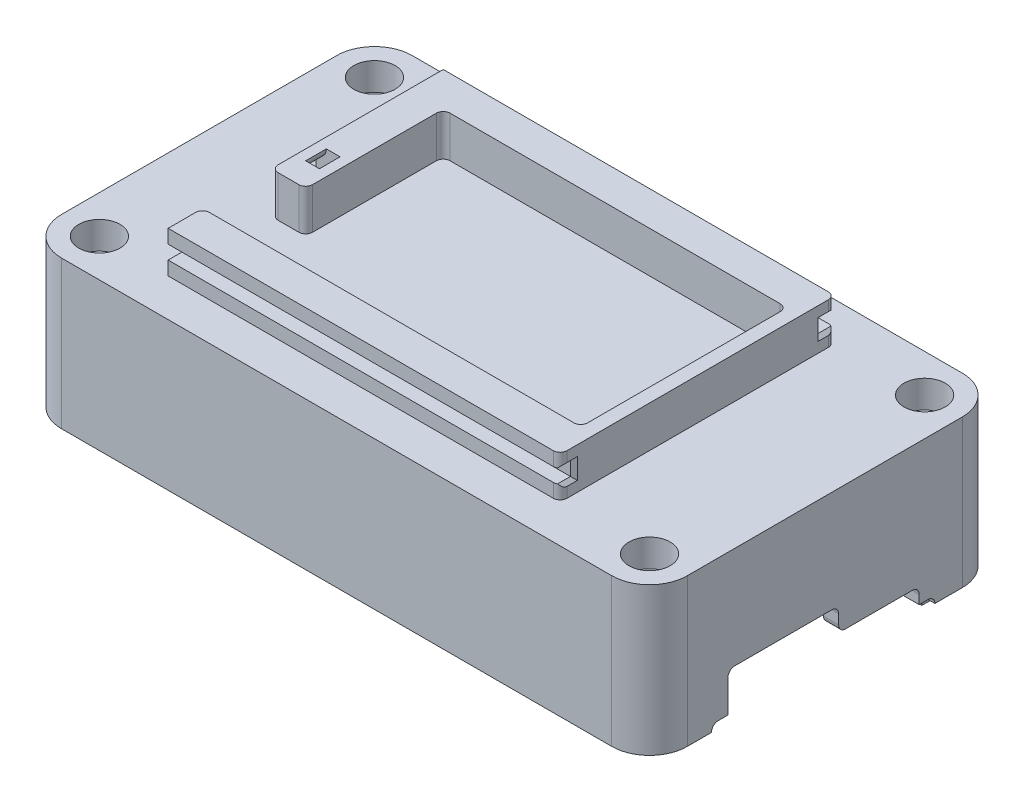
from build123d import *

# Parameters (mm, degrees)
SKETCH_1_R          = 1.65
EXTRUDE_1_DEPTH     = 20
EXTRUDE_1_2_DEPTH   = 20
EXTRUDE_1_3_DEPTH   = 20
EXTRUDE_1_4_DEPTH   = 20
SKETCH_2_R          = 1.65
EXTRUDE_2_DEPTH     = 3
SKETCH_3_R          = 3
CUT_EXTRUDE_1_DEPTH = 4
EXTRUDE_START       = 10.5
EXTRUDE_3_DEPTH     = 10.5
EXTRUDE_START_2     = 8
EXTRUDE_4_DEPTH     = 8
SKETCH_6_W          = 2.2
SKETCH_6_H          = 13
EXTRUDE_5_DEPTH     = 4.7
SKETCH_7_W          = 29
SKETCH_7_H          = 2.2
EXTRUDE_6_DEPTH     = 3
SKETCH_8_W          = 10
SKETCH_8_H          = 2.2
EXTRUDE_7_DEPTH     = 5
FILLET_3_R          = 1
EXTRUDE_8_DEPTH     = 6
EXTRUDE_9_DEPTH     = 2.2
EXTRUDE_10_DEPTH    = 2.2
FILLET_5_R          = 1
SKETCH_13_W         = 2
SKETCH_13_H         = 2
CUT_EXTRUDE_2_DEPTH = 93.185953377
CUT_EXTRUDE_3_REACH = 106.168
SKETCH_14_W         = 5
SKETCH_14_H         = 10
CHAMFER_1_SIZE      = 0.5
SWEEP_START         = -25
SWEEP_1_DEPTH       = 3
FILLET_6_R          = 1


# Read off the part's stored shape, not the designer's step: 切除-扫描1
with BuildPart() as part:
    # 草图1 → 凸台-拉伸1 (new body)
    with BuildSketch(Plane(origin=(0, 0, 0), x_dir=(1, 0, 0), z_dir=(0, 1, 0))):
        with BuildLine():
            Line((0.2, 3.5), (0.2, 7.2))
            Line((0.2, 7.2), (3.7, 7.2))
            ThreePointArc((3.7, 7.2), (6.174873734, 6.174873734), (7.2, 3.7))
            Line((7.2, 3.7), (7.2, 0.2))
            Line((7.2, 0.2), (3.5, 0.2))
            ThreePointArc((3.5, 0.2), (1.166547622, 1.166547622), (0.2, 3.5))
        make_face()
        with Locations(Location((3.5, 3.5, 0), (0, 0, 270))):
            Circle(SKETCH_1_R, mode=Mode.SUBTRACT)
    extrude(amount=EXTRUDE_1_DEPTH)



with BuildPart() as body_2:
    # 草图1 → Extrude 1 2 (new body)
    with BuildSketch(Plane(origin=(0, 0, 0), x_dir=(1, 0, 0), z_dir=(0, 1, 0))):
        with BuildLine():
            Line((3.5, 46.8), (7.2, 46.8))
            Line((7.2, 46.8), (7.2, 43.3))
            ThreePointArc((7.2, 43.3), (6.174873734, 40.825126266), (3.7, 39.8))
            Line((3.7, 39.8), (0.2, 39.8))
            Line((0.2, 39.8), (0.2, 43.5))
            ThreePointArc((0.2, 43.5), (1.166547622, 45.833452378), (3.5, 46.8))
        make_face()
        with Locations(Location((3.5, 43.5, 0), (0, 0, 270))):
            Circle(SKETCH_1_R, mode=Mode.SUBTRACT)
    extrude(amount=EXTRUDE_1_2_DEPTH)


with BuildPart() as body_3:
    # 草图1 → Extrude 1 3 (new body)
    with BuildSketch(Plane(origin=(0, 0, 0), x_dir=(1, 0, 0), z_dir=(0, 1, 0))):
        with BuildLine():
            Line((86.8, 3.5), (86.8, 7.2))
            Line((86.8, 7.2), (83.3, 7.2))
            ThreePointArc((83.3, 7.2), (80.825126266, 6.174873734), (79.8, 3.7))
            Line((79.8, 3.7), (79.8, 0.2))
            Line((79.8, 0.2), (83.5, 0.2))
            ThreePointArc((83.5, 0.2), (85.833452378, 1.166547622), (86.8, 3.5))
        make_face()
        with Locations(Location((83.5, 3.5, 0), (0, 0, 270))):
            Circle(SKETCH_1_R, mode=Mode.SUBTRACT)
    extrude(amount=EXTRUDE_1_3_DEPTH)


with BuildPart() as body_4:
    # 草图1 → Extrude 1 4 (new body)
    with BuildSketch(Plane(origin=(0, 0, 0), x_dir=(1, 0, 0), z_dir=(0, 1, 0))):
        with BuildLine():
            Line((79.8, 43.3), (79.8, 46.8))
            Line((79.8, 46.8), (83.5, 46.8))
            ThreePointArc((83.5, 46.8), (85.833452378, 45.833452378), (86.8, 43.5))
            Line((86.8, 43.5), (86.8, 39.8))
            Line((86.8, 39.8), (83.3, 39.8))
            ThreePointArc((83.3, 39.8), (80.825126266, 40.825126266), (79.8, 43.3))
        make_face()
        with Locations(Location((83.5, 43.5, 0), (0, 0, 270))):
            Circle(SKETCH_1_R, mode=Mode.SUBTRACT)
    extrude(amount=EXTRUDE_1_4_DEPTH)


with BuildPart() as part_1:
    add(part.part)

    add(body_2.part)  # 凸台-拉伸2 merges body 2

    add(body_3.part)  # 凸台-拉伸2 merges body 3

    add(body_4.part)  # 凸台-拉伸2 merges body 4
    # 草图2 → 凸台-拉伸2 (add)
    with BuildSketch(Plane(origin=(0, 20, 0), x_dir=(1, 0, 0), z_dir=(0, 1, 0))):
        with BuildLine():
            Line((3.5, 49), (83.5, 49))
            ThreePointArc((83.5, 49), (87.389087297, 47.389087297), (89, 43.5))
            Line((89, 43.5), (89, 3.5))
            ThreePointArc((89, 3.5), (87.389087297, -0.389087297), (83.5, -2))
            Line((83.5, -2), (3.5, -2))
            ThreePointArc((3.5, -2), (-0.389087297, -0.389087297), (-2, 3.5))
            Line((-2, 3.5), (-2, 43.5))
            ThreePointArc((-2, 43.5), (-0.389087297, 47.389087297), (3.5, 49))
        make_face()
        with Locations(Location((83.5, 43.5, 0), (0, 0, 270))):
            Circle(SKETCH_2_R, mode=Mode.SUBTRACT)
        with Locations(Location((83.5, 3.5, 0), (0, 0, 270))):
            Circle(SKETCH_2_R, mode=Mode.SUBTRACT)
        with Locations(Location((3.5, 43.5, 0), (0, 0, 270))):
            Circle(SKETCH_2_R, mode=Mode.SUBTRACT)
        with Locations(Location((3.5, 3.5, 0), (0, 0, 270))):
            Circle(SKETCH_2_R, mode=Mode.SUBTRACT)
    extrude(amount=EXTRUDE_2_DEPTH)

    # 草图3 → 切除-拉伸1 (cut)
    with BuildSketch(Plane(origin=(0, 23, 0), x_dir=(1, 0, 0), z_dir=(0, 1, 0))):
        with Locations(Location((3.5, 43.5, 0), (0, 0, 270))):
            Circle(SKETCH_3_R)
        with Locations(Location((3.5, 3.5, 0), (0, 0, 270))):
            Circle(SKETCH_3_R)
        with Locations(Location((83.5, 3.5, 0), (0, 0, 270))):
            Circle(SKETCH_3_R)
        with Locations(Location((83.5, 43.5, 0), (0, 0, 270))):
            Circle(SKETCH_3_R)
    extrude(amount=-CUT_EXTRUDE_1_DEPTH, mode=Mode.SUBTRACT)

    # 草图4 → 凸台-拉伸3 (add)
    with BuildSketch(Plane.XZ.offset(-20).offset(EXTRUDE_START)):
        with BuildLine():
            Line((83.5, -49), (3.5, -49))
            ThreePointArc((3.5, -49), (-0.389087297, -47.389087297), (-2, -43.5))
            Line((-2, -43.5), (-2, -3.5))
            ThreePointArc((-2, -3.5), (-0.389087297, 0.389087297), (3.5, 2))
            Line((3.5, 2), (83.5, 2))
            ThreePointArc((83.5, 2), (87.389087297, 0.389087297), (89, -3.5))
            Line((89, -3.5), (89, -43.5))
            ThreePointArc((89, -43.5), (87.389087297, -47.389087297), (83.5, -49))
        make_face()
        with BuildLine():
            Line((86.8, -43.5), (86.8, -3.5))
            ThreePointArc((86.8, -3.5), (85.833452378, -1.166547622), (83.5, -0.2))
            Line((83.5, -0.2), (3.5, -0.2))
            ThreePointArc((3.5, -0.2), (1.166547622, -1.166547622), (0.2, -3.5))
            Line((0.2, -3.5), (0.2, -43.5))
            ThreePointArc((0.2, -43.5), (1.166547622, -45.833452378), (3.5, -46.8))
            Line((3.5, -46.8), (83.5, -46.8))
            ThreePointArc((83.5, -46.8), (85.833452378, -45.833452378), (86.8, -43.5))
        make_face(mode=Mode.SUBTRACT)
    extrude(amount=-EXTRUDE_3_DEPTH)

    # 草图5 → 凸台-拉伸4 (add)
    with BuildSketch(Plane.XZ.offset(-9.5).offset(EXTRUDE_START_2)):
        with BuildLine():
            Line((3.5, -49), (49, -49))
            Line((49, -49), (49, -46.8))
            Line((49, -46.8), (7.2, -46.8))
            Line((7.2, -46.8), (3.5, -46.8))
            ThreePointArc((3.5, -46.8), (1.166547622, -45.833452378), (0.2, -43.5))
            Line((0.2, -43.5), (0.2, -39.8))
            Line((0.2, -39.8), (0.2, -27))
            Line((0.2, -27), (-2, -27))
            Line((-2, -27), (-2, -43.5))
            ThreePointArc((-2, -43.5), (-0.389087297, -47.389087297), (3.5, -49))
        make_face()
        with BuildLine():
            Line((89, -43.5), (89, -39.5))
            Line((89, -39.5), (86.8, -39.5))
            Line((86.8, -39.5), (86.8, -39.8))
            Line((86.8, -39.8), (86.8, -43.5))
            ThreePointArc((86.8, -43.5), (85.833452378, -45.833452378), (83.5, -46.8))
            Line((83.5, -46.8), (79.8, -46.8))
            Line((79.8, -46.8), (78, -46.8))
            Line((78, -46.8), (78, -49))
            Line((78, -49), (83.5, -49))
            ThreePointArc((83.5, -49), (87.389087297, -47.389087297), (89, -43.5))
        make_face()
        with BuildLine():
            Line((83.5, 2), (3.5, 2))
            ThreePointArc((3.5, 2), (-0.389087297, 0.389087297), (-2, -3.5))
            Line((-2, -3.5), (-2, -7.5))
            Line((-2, -7.5), (0.2, -7.5))
            Line((0.2, -7.5), (0.2, -7.2))
            Line((0.2, -7.2), (0.2, -3.5))
            ThreePointArc((0.2, -3.5), (1.166547622, -1.166547622), (3.5, -0.2))
            Line((3.5, -0.2), (7.2, -0.2))
            Line((7.2, -0.2), (79.8, -0.2))
            Line((79.8, -0.2), (83.5, -0.2))
            ThreePointArc((83.5, -0.2), (85.833452378, -1.166547622), (86.8, -3.5))
            Line((86.8, -3.5), (86.8, -7))
            Line((86.8, -7), (89, -7))
            Line((89, -7), (89, -3.5))
            ThreePointArc((89, -3.5), (87.389087297, 0.389087297), (83.5, 2))
        make_face()
    extrude(amount=-EXTRUDE_4_DEPTH)

    # 草图6 → 凸台-拉伸5 (add)
    with BuildSketch(Plane.XZ.offset(-9.5)):
        with Locations((87.9, -33)):
            Rectangle(SKETCH_6_W, SKETCH_6_H)
    extrude(amount=EXTRUDE_5_DEPTH)

    # 草图7 → 凸台-拉伸6 (add)
    with BuildSketch(Plane.XZ.offset(-9.5)):
        with Locations((63.5, -47.9)):
            Rectangle(SKETCH_7_W, SKETCH_7_H)
    extrude(amount=EXTRUDE_6_DEPTH)

    # 草图8 → 凸台-拉伸7 (add)
    with BuildSketch(Plane.XZ.offset(-6.5)):
        with Locations((54, -47.9)):
            Rectangle(SKETCH_8_W, SKETCH_8_H)
    extrude(amount=EXTRUDE_7_DEPTH)

    # 圆角3
    fillet_3_edges = [part_1.edges().sort_by_distance(p)[0] for p in [
        (7.2, 20, -1.95),
        (86.8, 20, -23.5),
        (43.5, 20, -0.2),
        (0.2, 20, -23.5),
        (43.5, 20, -46.8),
        (6.174873734, 20, -6.174873734),
        (-0.9, 9.5, -27),
        (-0.9, 1.5, -27),
        (1.95, 20, -7.2),
        (-0.9, 9.5, -7.5),
        (87.9, 4.8, -26.5),
        (87.9, 4.8, -39.5),
        (78, 6.5, -47.9),
        (59, 6.5, -47.9),
        (59, 1.5, -47.9),
        (1.95, 20, -39.8),
        (6.174873734, 20, -40.825126266),
        (7.2, 20, -45.05),
        (79.8, 20, -45.05),
        (80.825126266, 20, -40.825126266),
        (85.05, 20, -39.8),
        (85.05, 20, -7.2),
        (80.825126266, 20, -6.174873734),
        (79.8, 20, -1.95),
    ]]
    fillet(fillet_3_edges, radius=FILLET_3_R)

    # 草图9 → 凸台-拉伸8 (add)
    with BuildSketch(Plane(origin=(0, 23, 0), x_dir=(1, 0, 0), z_dir=(0, 1, 0))):
        Polygon((18.5, 38.5), (68.5, 38.5), (68.5, 8.5), (18.5, 8.5), (13.5, 8.5), (13.5, 3.5), (70.5, 3.5), (70.5, 43.5), (13.5, 43.5), (13.5, 18.5), (18.5, 18.5), align=None)
    extrude(amount=EXTRUDE_8_DEPTH)

    # 草图11 → 凸台-拉伸9 (add)
    with BuildSketch(Plane(origin=(89, 0, 0), x_dir=(0, 0, -1), z_dir=(1, 0, 0))):
        with BuildLine():
            Line((26.5, 9.5), (7, 9.5))
            Line((7, 9.5), (7, 2.5))
            Line((7, 2.5), (9.4, 2.5))
            Line((9.4, 2.5), (9.4, 8.2))
            Line((9.4, 8.2), (25.5, 8.2))
            Line((25.5, 8.2), (25.5, 4.8))
            Line((25.5, 4.8), (27.5, 4.8))
            ThreePointArc((27.5, 4.8), (26.792893219, 5.092893219), (26.5, 5.8))
            Line((26.5, 5.8), (26.5, 9.5))
        make_face()
        with BuildLine():
            Line((39.5, 2.5), (39.5, 3.8))
            ThreePointArc((39.5, 3.8), (39.207106781, 4.507106781), (38.5, 4.8))
            Line((38.5, 4.8), (37.2, 4.8))
            Line((37.2, 4.8), (37.2, 2.5))
            Line((37.2, 2.5), (39.5, 2.5))
        make_face()
    extrude(amount=-EXTRUDE_9_DEPTH)

    # 草图12 → 凸台-拉伸10 (add)
    with BuildSketch(Plane.ZY.offset(2)):
        with BuildLine():
            Line((-7.5, 1.5), (-7.5, 8.5))
            ThreePointArc((-7.5, 8.5), (-7.792893219, 9.207106781), (-8.5, 9.5))
            Line((-8.5, 9.5), (-26, 9.5))
            ThreePointArc((-26, 9.5), (-26.707106781, 9.207106781), (-27, 8.5))
            Line((-27, 8.5), (-27, 2.5))
            ThreePointArc((-27, 2.5), (-27.292893219, 1.792893219), (-28, 1.5))
            Line((-28, 1.5), (-24.8, 1.5))
            Line((-24.8, 1.5), (-24.8, 8.6))
            Line((-24.8, 8.6), (-8.8, 8.6))
            Line((-8.8, 8.6), (-8.8, 1.5))
            Line((-8.8, 1.5), (-7.5, 1.5))
        make_face()
    extrude(amount=-EXTRUDE_10_DEPTH)

    # 圆角5
    # the kernel refuses this fillet: 1 mm, written as the material it adds along each edge
    with BuildSketch(Plane(origin=(89, 2.5, -39.5), x_dir=(0, 0, 1), z_dir=(-1, 0, 0)), Plane(origin=(-2, 8.6, -8.8), x_dir=(0, 0, -1), z_dir=(1, 0, 0)), Plane(origin=(-2, 8.6, -24.8), x_dir=(0, -1, 0), z_dir=(1, 0, 0))) as fillet_5_piece_1:
        with BuildLine():
            CenterArc((FILLET_5_R, -FILLET_5_R), FILLET_5_R, 90, 90)
            Line((0, -FILLET_5_R), (0, 0))
            Line((0, 0), (FILLET_5_R, 0))
        make_face()
    extrude(amount=2.2)
    with BuildSketch(Plane(origin=(89, 4.8, -37.2), x_dir=(0, -1, 0), z_dir=(-1, 0, 0)), Plane(origin=(89, 8.2, -25.5), x_dir=(0, -1, 0), z_dir=(-1, 0, 0)), Plane(origin=(89, 8.2, -9.4), x_dir=(0, 0, -1), z_dir=(-1, 0, 0)), Plane(origin=(89, 2.5, -7), x_dir=(0, 0, -1), z_dir=(-1, 0, 0))) as fillet_5_piece_2:
        with BuildLine():
            CenterArc((FILLET_5_R, FILLET_5_R), FILLET_5_R, 180, 90)
            Line((0, FILLET_5_R), (0, 0))
            Line((0, 0), (FILLET_5_R, 0))
        make_face()
    extrude(amount=2.2)
    # the kernel refuses this fillet: 1 mm, written as the material it takes off along each edge
    with BuildSketch(Plane(origin=(91.5, 4.8, -25.5), x_dir=(0, 1, 0), z_dir=(-1, 0, 0))) as fillet_5_2_piece_1:
        with BuildLine():
            CenterArc((FILLET_5_R, FILLET_5_R), FILLET_5_R, 180, 90)
            Line((0, FILLET_5_R), (0, 0))
            Line((0, 0), (FILLET_5_R, 0))
        make_face()
    extrude(amount=7.2, mode=Mode.SUBTRACT)

    # 草图13 → 切除-拉伸2 (cut, through all)
    with BuildSketch(Plane(origin=(70.5, 0, 0), x_dir=(0, 0, -1), z_dir=(1, 0, 0))):
        with Locations((4.5, 26)):
            Rectangle(SKETCH_13_W, SKETCH_13_H)
        with Locations((42.5, 26)):
            Rectangle(SKETCH_13_W, SKETCH_13_H)
    extrude(amount=-CUT_EXTRUDE_2_DEPTH, mode=Mode.SUBTRACT)

    # 草图14 → 切除-拉伸3 (cut, up to next)
    with BuildSketch(Plane(origin=(0, 23, 0), x_dir=(1, 0, 0), z_dir=(0, 1, 0)), mode=Mode.PRIVATE) as cut_extrude_3_sk1:
        with Locations((66, 33.5)):
            Rectangle(SKETCH_14_W, SKETCH_14_H)
    cut_extrude_3_tool1 = extrude(cut_extrude_3_sk1.sketch, amount=-CUT_EXTRUDE_3_REACH, mode=Mode.PRIVATE) & part_1.part
    add(cut_extrude_3_tool1.solids().sort_by_distance((66, 23, -33.5))[0], mode=Mode.SUBTRACT)

    # 倒角1
    chamfer_1_edges = [part_1.edges().sort_by_distance(p)[0] for p in [
        (70.5, 25, -4.5),
        (70.5, 26, -5.5),
        (70.5, 27, -4.5),
        (70.5, 27, -42.5),
        (70.5, 26, -41.5),
        (70.5, 25, -42.5),
    ]]
    chamfer(chamfer_1_edges, length=CHAMFER_1_SIZE)

    # 切除-扫描1 outline → 切除-扫描1 (cut)
    with BuildSketch(Plane.XY.offset(SWEEP_START)):
        with BuildLine():
            add(Edge.make_bspline(
                [(17.000000001, 29.000010711), (17.000000001, 29.000007141), (17, 29.00000357), (16.999989924, 28.86720552), (16.990582948, 28.708447161), (16.953077688, 28.415689535), (16.924980494, 28.269122933), (16.811726434, 27.831447234), (16.698064575, 27.542553127), (16.22378829, 26.711327095), (15.764379255, 26.259878238), (14.953643087, 25.8010381), (14.676131506, 25.69177004), (14.119716671, 25.54410443), (13.821557574, 25.505802142), (13.546614415, 25.500225626), (13.523049512, 25.499873133), (13.499989423, 25.499646213)],
                knots=[0.174620175, 0.174620175, 0.174620175, 0.174620175, 0.174621562, 0.174621562, 0.226207714, 0.226207714, 0.277793867, 0.277793867, 0.380966172, 0.380966172, 0.587310781, 0.587310781, 0.690483086, 0.690483086, 0.793655391, 0.793655391, 0.803579895, 0.803579895, 0.803579895, 0.803579895], degree=3))
            Line((17.000000001, 29.000010711), (15, 29.000009231))
            add(Edge.make_bspline(
                [(15, 29.000009231), (15, 29.000006154), (15, 29.000003077), (14.999997514, 28.92882097), (14.996146854, 28.879466652), (14.979939669, 28.752957027), (14.967594623, 28.688377424), (14.917816424, 28.496007209), (14.867182057, 28.369391548), (14.674171933, 28.031116911), (14.459840195, 27.819657349), (14.128293923, 27.632018705), (14.0064104, 27.583266659), (13.763404695, 27.518775954), (13.661534823, 27.502962932), (13.520439975, 27.500106443), (13.510326063, 27.499952809), (13.499995786, 27.499844051)],
                knots=[0.174619332, 0.174619332, 0.174619332, 0.174619332, 0.174621562, 0.174621562, 0.226207714, 0.226207714, 0.277793867, 0.277793867, 0.380966172, 0.380966172, 0.587310781, 0.587310781, 0.690483086, 0.690483086, 0.793655391, 0.793655391, 0.801421968, 0.801421968, 0.801421968, 0.801421968], degree=3))
            Line((13.499995786, 27.499844051), (13.499989423, 25.499646213))
        make_face()
    extrude(amount=SWEEP_1_DEPTH, mode=Mode.SUBTRACT)

    # 圆角6
    fillet_6_edges = [part_1.edges().sort_by_distance(p)[0] for p in [
        (13.5, 26, -8.5),
        (13.5, 26, -18.5),
        (18.5, 26, -18.5),
        (18.5, 26, -38.5),
        (68.5, 26, -8.5),
        (68.5, 24.5, -38.5),
        (63.5, 21.5, -38.5),
        (63.5, 21.5, -28.5),
        (68.5, 21.5, -28.5),
        (70.5, 23.75, -43.5),
        (70.5, 28.25, -43.5),
        (70.5, 23.75, -3.5),
        (70.5, 28.25, -3.5),
    ]]
    fillet(fillet_6_edges, radius=FILLET_6_R)


solid = part_1.part
